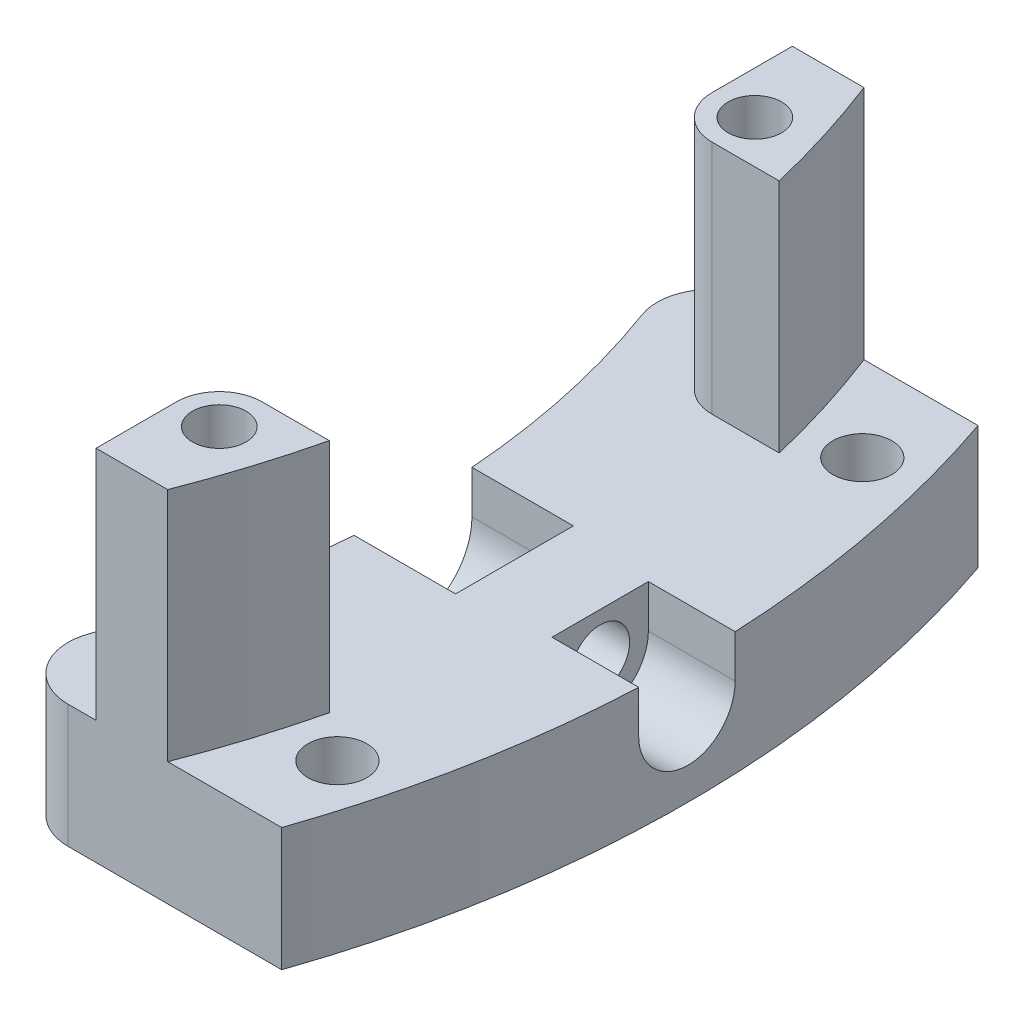
from build123d import *

# Parameters (mm, degrees)
BOSS_EXTRUDE1_DEPTH = 11.5
BOSS_EXTRUDE2_DEPTH = 22
SKETCH3_R           = 2.5
CUT_EXTRUDE1_DEPTH  = 4
SKETCH4_R           = 4.5
CUT_EXTRUDE2_DEPTH  = 5
SKETCH5_R           = 2.75
CUT_EXTRUDE3_DEPTH  = 109.942645461
SKETCH6_R           = 2.75
CUT_EXTRUDE4_DEPTH  = 58.120859524
CUT_EXTRUDE5_DEPTH  = 8.2
SKETCH7_W           = 12
SKETCH7_H           = 11
CUT_EXTRUDE6_DEPTH  = 9.5
FILLET1_R           = 5.5
FILLET2_R           = 5


with BuildPart() as part:
    # Sketch1 → Boss-Extrude1 (new body)
    with BuildSketch(Plane(origin=(0, 0, 0), x_dir=(1, 0, 0), z_dir=(0, 1, 0))):
        with BuildLine():
            Line((67.071401597, -32.5), (94.571401597, -32.5))
            ThreePointArc((94.571401597, -32.5), (100, 0), (94.571401597, 32.5))
            Line((94.571401597, 32.5), (67.071401597, 32.5))
            ThreePointArc((67.071401597, 32.5), (74.530684367, 0), (67.071401597, -32.5))
        make_face()
    extrude(amount=BOSS_EXTRUDE1_DEPTH)

    # Sketch2 → Boss-Extrude2 (add)
    with BuildSketch(Plane.XZ.offset(-11.5)):
        with BuildLine():
            Line((81.240384046, 21), (87.515712875, 21))
            ThreePointArc((87.515712875, 21), (85.914014443, 26.810112315), (83.927051658, 32.5))
            Line((83.927051658, 32.5), (77.240384046, 32.5))
            Line((77.240384046, 32.5), (77.240384046, 25))
            ThreePointArc((77.240384046, 25), (78.411956922, 22.171572875), (81.240384046, 21))
        make_face()
        with BuildLine():
            Line((77.240384046, -25), (77.240384046, -32.5))
            Line((77.240384046, -32.5), (83.927051658, -32.5))
            ThreePointArc((83.927051658, -32.5), (85.914014443, -26.810112315), (87.515712875, -21))
            Line((87.515712875, -21), (81.240384046, -21))
            ThreePointArc((81.240384046, -21), (78.411956922, -22.171572875), (77.240384046, -25))
        make_face()
    extrude(amount=-BOSS_EXTRUDE2_DEPTH)

    # Sketch3 → Cut-Extrude1 (cut)
    with BuildSketch(Plane(origin=(0, 33.5, 0), x_dir=(1, 0, 0), z_dir=(0, 1, 0))):
        with Locations(Location((81.240384046, 25, 0), (0, 0, 270))):
            Circle(SKETCH3_R)
        with Locations(Location((81.240384046, -25, 0), (0, 0, 270))):
            Circle(SKETCH3_R)
    extrude(amount=-CUT_EXTRUDE1_DEPTH, mode=Mode.SUBTRACT)

    # Sketch4 → Cut-Extrude2 (cut)
    with BuildSketch(Plane.XZ):
        with Locations(Location((91.768319444, 24.5, 0), (0, 0, 270))):
            Circle(SKETCH4_R)
        with Locations(Location((91.768319444, -24.5, 0), (0, 0, 270))):
            Circle(SKETCH4_R)
    extrude(amount=-CUT_EXTRUDE2_DEPTH, mode=Mode.SUBTRACT)

    # Sketch5 → Cut-Extrude3 (cut, through all)
    with BuildSketch(Plane.XZ.offset(-5)):
        with Locations(Location((91.768319444, 24.5, 0), (0, 0, 270))):
            Circle(SKETCH5_R)
        with Locations(Location((91.768319444, -24.5, 0), (0, 0, 270))):
            Circle(SKETCH5_R)
    extrude(amount=-CUT_EXTRUDE3_DEPTH, mode=Mode.SUBTRACT)

    # Sketch6 → Cut-Extrude4 (cut, through all)
    with BuildSketch(Plane.ZY.offset(-67.071401597)):
        with Locations((0, 7.5)):
            Circle(SKETCH6_R)
    extrude(amount=-CUT_EXTRUDE4_DEPTH, mode=Mode.SUBTRACT)

    # Sketch8 → Cut-Extrude5 (cut)
    with BuildSketch(Plane(origin=(100, 0, 0), x_dir=(0, 0, -1), z_dir=(1, 0, 0))):
        with BuildLine():
            Line((-4.5, 7.5), (-4.5, 11.5))
            Line((-4.5, 11.5), (4.5, 11.5))
            Line((4.5, 11.5), (4.5, 7.5))
            ThreePointArc((4.5, 7.5), (0, 3), (-4.5, 7.5))
        make_face()
    extrude(amount=-CUT_EXTRUDE5_DEPTH, mode=Mode.SUBTRACT)

    # Sketch7 → Cut-Extrude6 (cut)
    with BuildSketch(Plane(origin=(0, 11.5, 0), x_dir=(1, 0, 0), z_dir=(0, 1, 0))):
        with Locations((77.8, 0)):
            Rectangle(SKETCH7_W, SKETCH7_H)
    extrude(amount=-CUT_EXTRUDE6_DEPTH, mode=Mode.SUBTRACT)

    # Fillet1
    # the kernel refuses this fillet: 5.5 mm, written as the material it adds along each edge
    with BuildSketch(Plane(origin=(60.577470777, 2, 5.5), x_dir=(0, 1, 0), z_dir=(1, 0, 0))) as fillet1_piece_1_section:
        with BuildLine():
            CenterArc((FILLET1_R, -FILLET1_R), FILLET1_R, 90, 90)
            Line((0, -FILLET1_R), (0, 0))
            Line((0, 0), (FILLET1_R, 0))
        make_face()
    fillet1_piece_1 = extrude(amount=36.972529223, mode=Mode.PRIVATE)
    fillet1_piece_1 = fillet1_piece_1 - Plane(origin=(0, 3.249781121, 0), x_dir=(0.899916620473715, 0, -0.43606200957566527), z_dir=(0, -1, 0)) * Cylinder(74.530684367, 96, mode=Mode.PRIVATE)
    add(fillet1_piece_1)
    with BuildSketch(Plane(origin=(97.55, 2, -5.5), x_dir=(0, 0, 1), z_dir=(-1, 0, 0))) as fillet1_piece_2_section:
        with BuildLine():
            CenterArc((FILLET1_R, FILLET1_R), FILLET1_R, 180, 90)
            Line((0, FILLET1_R), (0, 0))
            Line((0, 0), (FILLET1_R, 0))
        make_face()
    fillet1_piece_2 = extrude(amount=36.972529223, mode=Mode.PRIVATE)
    fillet1_piece_2 = fillet1_piece_2 - Plane(origin=(0, 3.245173128, 0), x_dir=(0.899916620473715, 0, -0.43606200957566527), z_dir=(0, -1, 0)) * Cylinder(74.530684367, 96, mode=Mode.PRIVATE)
    add(fillet1_piece_2)

    # Fillet2
    fillet2_edges = [part.edges().sort_by_distance(p)[0] for p in [
        (67.071401597, 5.75, 32.5),
        (67.071401597, 5.75, -32.5),
    ]]
    fillet(fillet2_edges, radius=FILLET2_R)


solid = part.part
